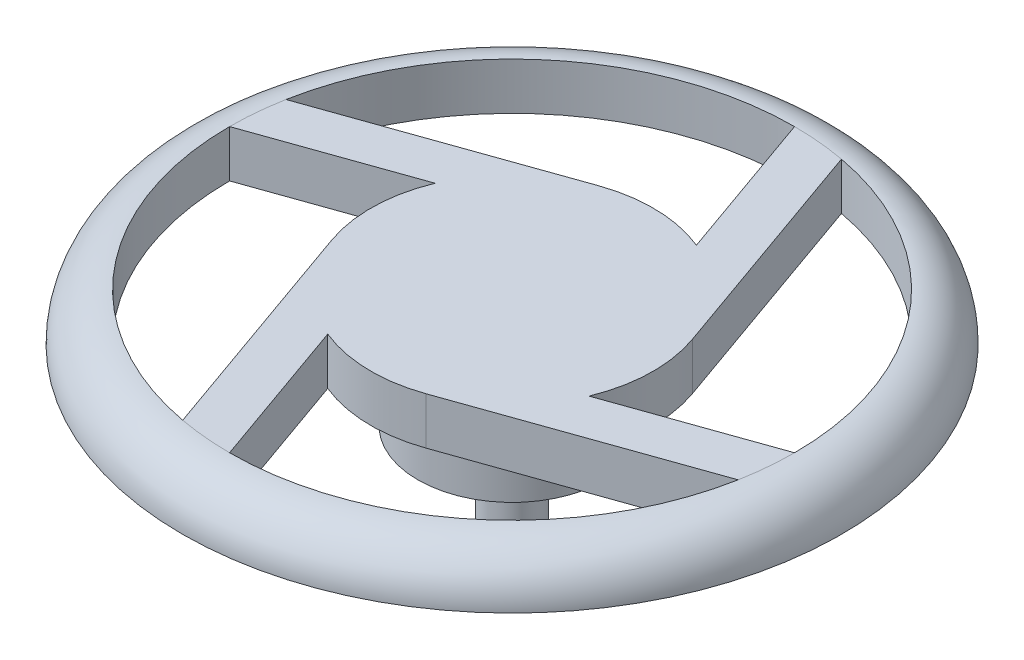
from build123d import *

# Parameters (mm, degrees)
SKETCH5_R           = 30
SKETCH5_R_2         = 20
EXTRUDE_THIN2_DEPTH = 10
SKETCH2_R           = 70
SKETCH2_R_2         = 60
BOSS_EXTRUDE3_DEPTH = 10
CIRPATTERN1_COUNT   = 4
BOSS_EXTRUDE4_START = -25
SKETCH6_R           = 20
BOSS_EXTRUDE4_DEPTH = 25
FILLET2_R           = 10
SKETCH7_R           = 5.5
BOSS_EXTRUDE5_DEPTH = 22


with BuildPart() as part:
    # Sketch5 → Extrude-Thin2 (new body)
    # profile 1 of 2: a face of its own
    with BuildSketch(Plane(origin=(0, 0, 0), x_dir=(1, 0, 0), z_dir=(0, 1, 0))):
        Circle(SKETCH5_R)
        Circle(SKETCH5_R_2, mode=Mode.SUBTRACT)
    # profile 2 of 2: a face of its own
    with BuildSketch(Plane(origin=(0, 0, 0), x_dir=(1, 0, 0), z_dir=(0, 1, 0))):
        Polygon((6.666666667, -18.856180832), (60, 0), (63.333333333, -9.428090416), (10, -28.284271247), align=None)
    extrude_thin2 = extrude(amount=EXTRUDE_THIN2_DEPTH)

    # Sketch2 → Boss-Extrude3 (add)
    with BuildSketch(Plane(origin=(0, 0, 0), x_dir=(1, 0, 0), z_dir=(0, 1, 0))):
        with Locations(Location((0, 0, 0), (0, 0, 270))):
            Circle(SKETCH2_R)
        Circle(SKETCH2_R_2, mode=Mode.SUBTRACT)
    extrude(amount=BOSS_EXTRUDE3_DEPTH)

    # CirPattern1: Extrude-Thin2 ×4 about axis
    cirpattern1_axis = Axis((0, 0, 0), (0, 1, 0))
    for i in range(1, CIRPATTERN1_COUNT):
        add(extrude_thin2.rotate(cirpattern1_axis, i * 360 / CIRPATTERN1_COUNT))

    # Sketch6 → Boss-Extrude4 (add)
    with BuildSketch(Plane(origin=(0, 10, 0), x_dir=(1, 0, 0), z_dir=(0, 1, 0)).offset(BOSS_EXTRUDE4_START)):
        with Locations(Location((0, 0, 0), (0, 0, 270))):
            Circle(SKETCH6_R)
    extrude(amount=BOSS_EXTRUDE4_DEPTH)

    # Fillet2
    fillet2_edges = [part.edges().sort_by_distance(p)[0] for p in [
        (0, 10, -70),
    ]]
    fillet(fillet2_edges, radius=FILLET2_R - 0.0001)  # a hair under: the kernel refuses the full size

    # Sketch7 → Boss-Extrude5 (add)
    with BuildSketch(Plane.XZ.offset(15)):
        with Locations(Location((0, 0, 0), (0, 0, 270))):
            Circle(SKETCH7_R)
    extrude(amount=BOSS_EXTRUDE5_DEPTH)


solid = part.part
